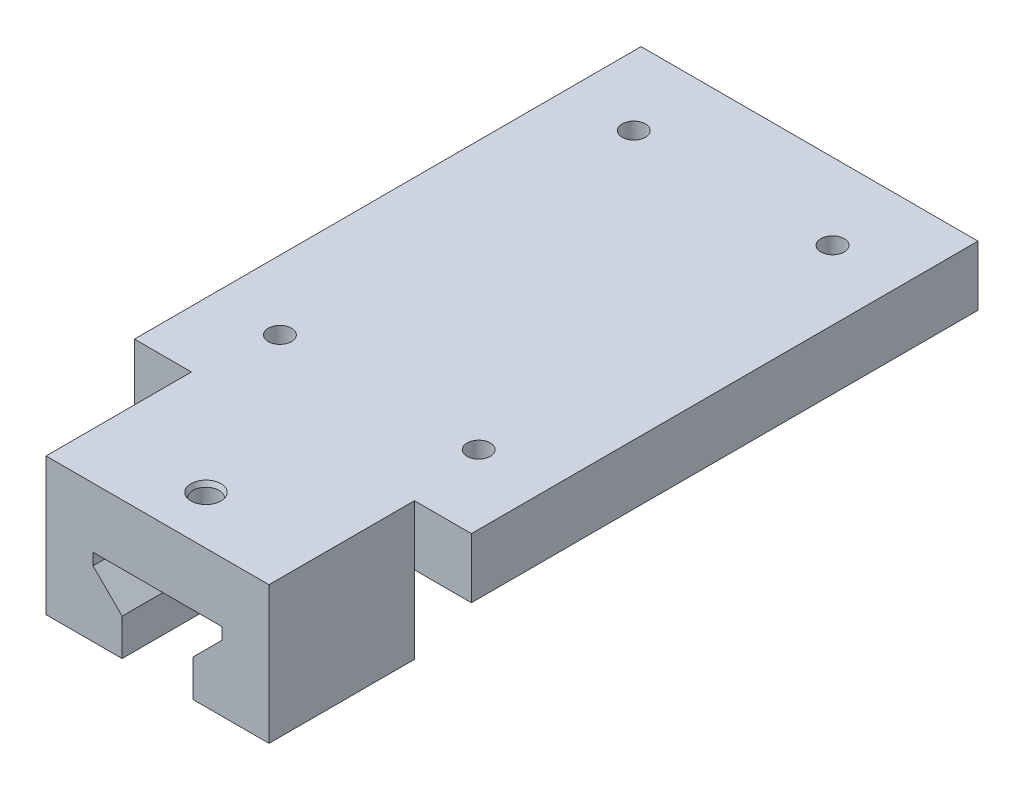
from build123d import *

# Parameters (mm, degrees)
BOSS_EXTRUDE1_DEPTH            = 30
HOLE1_D                        = 5.4
HOLE1_CBORE_D                  = 6.2
HOLE1_CBORE_DEPTH              = 1
CHAMFER1_SIZE2                 = 0.4
CHAMFER1_SIZE                  = 1
SKETCH5_W                      = 69.5
SKETCH5_H                      = 104.5
BOSS_EXTRUDE2_DEPTH            = 12.35
CBORE_FOR_M4_SHCS1_D           = 4.8
CBORE_FOR_M4_SHCS1_CBORE_D     = 8
CBORE_FOR_M4_SHCS1_CBORE_DEPTH = 4


with BuildPart() as part:
    # Sketch1 → Boss-Extrude1 (new body)
    with BuildSketch(Plane.XY):
        Polygon((-7.3, 0.3), (-7.3, 7.875735931), (-13.3, 13.875735931), (-13.3, 16.3), (13.3, 16.3), (13.3, 13.875735931), (7.3, 7.875735931), (7.3, 0.3), (23, 0.3), (23, 28.65), (-23, 28.65), (-23, 0.3), align=None)
    extrude(amount=BOSS_EXTRUDE1_DEPTH)

    # Hole1 (through all)
    with Locations(Plane(origin=(0, 28.65, 0), x_dir=(1, 0, 0), z_dir=(0, 1, 0))):
        with Locations((0, -20)):
            CounterBoreHole(HOLE1_D / 2, HOLE1_CBORE_D / 2, HOLE1_CBORE_DEPTH)

    # Chamfer1
    chamfer1_edges = [part.edges().sort_by_distance(p)[0] for p in [
        (-3.1, 27.65, 20),
    ]]
    chamfer1_side = [part.faces().sort_by_distance(p)[0] for p in [
        (-3.1, 27.658, 20),
    ]]
    chamfer(chamfer1_edges, length=CHAMFER1_SIZE - 0.0001, length2=CHAMFER1_SIZE2 - 0.0001, reference=chamfer1_side[0])  # a hair under: the kernel refuses the full size

    # Sketch5 → Boss-Extrude2 (add)
    with BuildSketch(Plane(origin=(0, 28.65, 0), x_dir=(1, 0, 0), z_dir=(0, 1, 0))):
        with Locations((0, 52.25)):
            Rectangle(SKETCH5_W, SKETCH5_H)
    extrude(amount=-BOSS_EXTRUDE2_DEPTH)

    # CBORE for M4 SHCS1 (through all)
    with Locations(Plane(origin=(0, 16.3, 0), x_dir=(-1, 0, 0), z_dir=(0, -1, 0))):
        with Locations((-20.5, 88.75), (20.5, 88.75), (-20.5, 15.75), (20.5, 15.75)):
            CounterBoreHole(CBORE_FOR_M4_SHCS1_D / 2, CBORE_FOR_M4_SHCS1_CBORE_D / 2, CBORE_FOR_M4_SHCS1_CBORE_DEPTH)


solid = part.part
